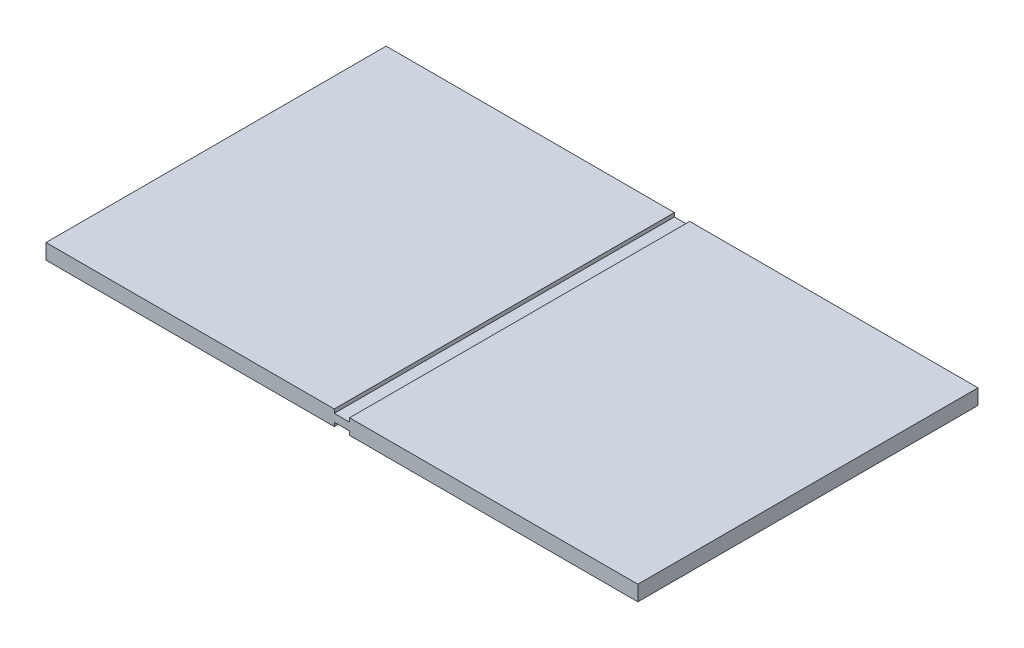
from build123d import *

# Parameters (mm, degrees)
SKETCH1_W           = 696
SKETCH1_H           = 400
BOSS_EXTRUDE1_DEPTH = 18
SKETCH2_W           = 18
SKETCH2_H           = 400
CUT_EXTRUDE1_DEPTH  = 4.5
SKETCH3_W           = 18
SKETCH3_H           = 400
CUT_EXTRUDE2_DEPTH  = 4.5


with BuildPart() as part:
    # Sketch1 → Boss-Extrude1 (new body)
    with BuildSketch(Plane(origin=(0, 0, 0), x_dir=(1, 0, 0), z_dir=(0, 1, 0))):
        Rectangle(SKETCH1_W, SKETCH1_H)
    extrude(amount=BOSS_EXTRUDE1_DEPTH)

    # Sketch2 → Cut-Extrude1 (cut)
    with BuildSketch(Plane(origin=(0, 18, 0), x_dir=(1, 0, 0), z_dir=(0, 1, 0))):
        Rectangle(SKETCH2_W, SKETCH2_H)
    extrude(amount=-CUT_EXTRUDE1_DEPTH, mode=Mode.SUBTRACT)

    # Sketch3 → Cut-Extrude2 (cut)
    with BuildSketch(Plane(origin=(0, 0, 0), x_dir=(-1, 0, 0), z_dir=(0, -1, 0))):
        Rectangle(SKETCH3_W, SKETCH3_H)
    extrude(amount=-CUT_EXTRUDE2_DEPTH, mode=Mode.SUBTRACT)


solid = part.part
